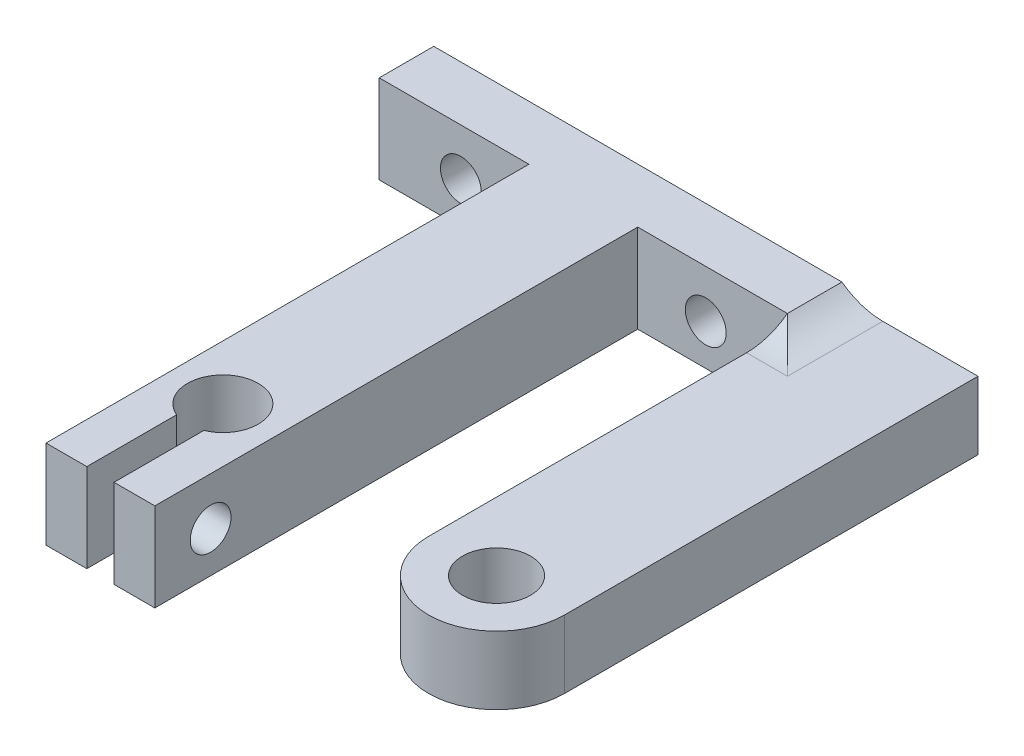
from build123d import *
from OCP.BRepFilletAPI import BRepFilletAPI_MakeChamfer

# Parameters (mm, degrees)
BOSS_EXTRUDE1_DEPTH      = 7
SKETCH2_R                = 1.5
CUT_EXTRUDE1_DEPTH       = 43.613787576
SKETCH3_R                = 1.5
CUT_EXTRUDE2_DEPTH       = 5
CHAMFER1_SIZE            = 0.5
CHAMFER1_SIZE2           = 0.595876796
BOSS_EXTRUDE2_DEPTH      = 2.5
BOSS_EXTRUDE2_DEPTH_BACK = 2.5
FILLET1_R                = 5
FILLET2_START            = -2.004201681
FILLET2_DEPTH            = 7.008403362
FILLET2_START_2          = 15
FILLET2_2_DEPTH          = 3


with BuildPart() as part:
    # Sketch1 → Boss-Extrude1 (new body)
    with BuildSketch(Plane(origin=(0, 0, 0), x_dir=(1, 0, 0), z_dir=(0, 1, 0))):
        with BuildLine():
            Line((15, 2.004201681), (-15, 2.004201681))
            Line((-15, 2.004201681), (-15, -2.004201681))
            Line((-15, -2.004201681), (-4, -2.004201681))
            Line((-4, -2.004201681), (-4, -37.495798319))
            Line((-4, -37.495798319), (-1, -37.495798319))
            Line((-1, -37.495798319), (-1, -30.895798319))
            ThreePointArc((-1, -30.895798319), (0, -25.895798319), (1, -30.895798319))
            Line((1, -30.895798319), (1, -37.495798319))
            Line((1, -37.495798319), (4, -37.495798319))
            Line((4, -37.495798319), (4, -2.004201681))
            Line((4, -2.004201681), (15, -2.004201681))
            Line((15, -2.004201681), (15, 2.004201681))
        make_face()
    extrude(amount=BOSS_EXTRUDE1_DEPTH)

    # Sketch2 → Cut-Extrude1 (cut, through all)
    with BuildSketch(Plane(origin=(4, 0, 0), x_dir=(0, 0, -1), z_dir=(1, 0, 0))):
        with Locations((-33.395798319, 3.5)):
            Circle(SKETCH2_R)
    extrude(amount=-CUT_EXTRUDE1_DEPTH, mode=Mode.SUBTRACT)

    # Sketch3 → Cut-Extrude2 (cut)
    with BuildSketch(Plane.XY.offset(2.004201681)):
        with Locations((9, 3.5)):
            Circle(SKETCH3_R)
        with Locations(Location((-9, 3.5, 0), (0, 0, 180))):
            Circle(SKETCH3_R)
    extrude(amount=-CUT_EXTRUDE2_DEPTH, mode=Mode.SUBTRACT)

    # Chamfer1: one chamfer whose edges measure the first distance from different faces: ONE call of the kernel's chamfer builder (chamfer() names one face for all edges)
    chamfer1_edges_1 = [part.edges().sort_by_distance(p)[0] for p in [
        (-1, 0, 34.195798319),
    ]]
    chamfer1_side_1 = [part.faces().sort_by_distance(p)[0] for p in [
        (-1, 3.5, 37.399590212),
    ]]
    chamfer1_edges_2 = [part.edges().sort_by_distance(p)[0] for p in [
        (-2.5, 0, 37.495798319),
    ]]
    chamfer1_side_2 = [part.faces().sort_by_distance(p)[0] for p in [
        (-2.5, 3.5, 37.495798319),
    ]]
    chamfer1_edges_3 = [part.edges().sort_by_distance(p)[0] for p in [
        (-4, 0, 19.75),
    ]]
    chamfer1_side_3 = [part.faces().sort_by_distance(p)[0] for p in [
        (-4, 3.5, 19.350383526),
    ]]
    chamfer1_edges_4 = [part.edges().sort_by_distance(p)[0] for p in [
        (-9.5, 0, 2.004201681),
    ]]
    chamfer1_side_4 = [part.faces().sort_by_distance(p)[0] for p in [
        (-14.869615952, 3.5, 2.004201681),
    ]]
    chamfer1_edges_5 = [part.edges().sort_by_distance(p)[0] for p in [
        (-15, 0, 0),
    ]]
    chamfer1_side_5 = [part.faces().sort_by_distance(p)[0] for p in [
        (-15, 3.5, 0),
    ]]
    chamfer1_edges_6 = [part.edges().sort_by_distance(p)[0] for p in [
        (0, 0, -2.004201681),
    ]]
    chamfer1_side_6 = [part.faces().sort_by_distance(p)[0] for p in [
        (0, 3.5, -2.004201681),
    ]]
    chamfer1_edges_7 = [part.edges().sort_by_distance(p)[0] for p in [
        (15, 0, 0),
    ]]
    chamfer1_side_7 = [part.faces().sort_by_distance(p)[0] for p in [
        (15, 3.5, 0),
    ]]
    chamfer1_edges_8 = [part.edges().sort_by_distance(p)[0] for p in [
        (9.5, 0, 2.004201681),
    ]]
    chamfer1_side_8 = [part.faces().sort_by_distance(p)[0] for p in [
        (4.130384048, 3.5, 2.004201681),
    ]]
    chamfer1_edges_9 = [part.edges().sort_by_distance(p)[0] for p in [
        (4, 0, 19.75),
    ]]
    chamfer1_side_9 = [part.faces().sort_by_distance(p)[0] for p in [
        (4, 3.5, 19.350383526),
    ]]
    chamfer1_edges_10 = [part.edges().sort_by_distance(p)[0] for p in [
        (2.5, 0, 37.495798319),
    ]]
    chamfer1_side_10 = [part.faces().sort_by_distance(p)[0] for p in [
        (2.5, 3.5, 37.495798319),
    ]]
    chamfer1_edges_11 = [part.edges().sort_by_distance(p)[0] for p in [
        (1, 0, 34.195798319),
    ]]
    chamfer1_side_11 = [part.faces().sort_by_distance(p)[0] for p in [
        (1, 3.5, 30.992006427),
    ]]
    chamfer1_edges_12 = [part.edges().sort_by_distance(p)[0] for p in [
        (0, 0, 25.895798319),
    ]]
    chamfer1_side_12 = [part.faces().sort_by_distance(p)[0] for p in [
        (0, 3.5, 25.895798319),
    ]]
    chamfer1 = BRepFilletAPI_MakeChamfer(part.part.solid().wrapped)
    for e in chamfer1_edges_1:
        chamfer1.Add(CHAMFER1_SIZE, CHAMFER1_SIZE2, e.wrapped, chamfer1_side_1[0].wrapped)  # the first distance lies on this face
    for e in chamfer1_edges_2:
        chamfer1.Add(CHAMFER1_SIZE, CHAMFER1_SIZE2, e.wrapped, chamfer1_side_2[0].wrapped)  # the first distance lies on this face
    for e in chamfer1_edges_3:
        chamfer1.Add(CHAMFER1_SIZE, CHAMFER1_SIZE2, e.wrapped, chamfer1_side_3[0].wrapped)  # the first distance lies on this face
    for e in chamfer1_edges_4:
        chamfer1.Add(CHAMFER1_SIZE, CHAMFER1_SIZE2, e.wrapped, chamfer1_side_4[0].wrapped)  # the first distance lies on this face
    for e in chamfer1_edges_5:
        chamfer1.Add(CHAMFER1_SIZE, CHAMFER1_SIZE2, e.wrapped, chamfer1_side_5[0].wrapped)  # the first distance lies on this face
    for e in chamfer1_edges_6:
        chamfer1.Add(CHAMFER1_SIZE, CHAMFER1_SIZE2, e.wrapped, chamfer1_side_6[0].wrapped)  # the first distance lies on this face
    for e in chamfer1_edges_7:
        chamfer1.Add(CHAMFER1_SIZE, CHAMFER1_SIZE2, e.wrapped, chamfer1_side_7[0].wrapped)  # the first distance lies on this face
    for e in chamfer1_edges_8:
        chamfer1.Add(CHAMFER1_SIZE, CHAMFER1_SIZE2, e.wrapped, chamfer1_side_8[0].wrapped)  # the first distance lies on this face
    for e in chamfer1_edges_9:
        chamfer1.Add(CHAMFER1_SIZE, CHAMFER1_SIZE2, e.wrapped, chamfer1_side_9[0].wrapped)  # the first distance lies on this face
    for e in chamfer1_edges_10:
        chamfer1.Add(CHAMFER1_SIZE, CHAMFER1_SIZE2, e.wrapped, chamfer1_side_10[0].wrapped)  # the first distance lies on this face
    for e in chamfer1_edges_11:
        chamfer1.Add(CHAMFER1_SIZE, CHAMFER1_SIZE2, e.wrapped, chamfer1_side_11[0].wrapped)  # the first distance lies on this face
    for e in chamfer1_edges_12:
        chamfer1.Add(CHAMFER1_SIZE, CHAMFER1_SIZE2, e.wrapped, chamfer1_side_12[0].wrapped)  # the first distance lies on this face
    add(Compound.cast(chamfer1.Shape()), mode=Mode.REPLACE)

    # Sketch4 → Boss-Extrude2 (add, two sides: drawn at the far end of the back side and taken through both)
    with BuildSketch(Plane(origin=(0, 3.5, 0), x_dir=(1, 0, 0), z_dir=(0, 1, 0)).offset(-BOSS_EXTRUDE2_DEPTH_BACK)):
        with BuildLine():
            Line((20, -23.382400921), (20, 2.004201681))
            Line((20, 2.004201681), (15, 2.004201681))
            Line((15, 2.004201681), (15, -28.382400921))
            ThreePointArc((15, -28.382400921), (16.464466094, -24.846867015), (20, -23.382400921))
        make_face()
        with BuildLine():
            Line((25, 2.004201681), (20, 2.004201681))
            Line((20, 2.004201681), (20, -23.382400921))
            ThreePointArc((20, -23.382400921), (23.535533906, -24.846867015), (25, -28.382400921))
            Line((25, -28.382400921), (25, 2.004201681))
        make_face()
        with BuildLine():
            ThreePointArc((25, -28.382400921), (23.535533906, -24.846867015), (20, -23.382400921))
            Line((20, -23.382400921), (20, -25.882400921))
            ThreePointArc((20, -25.882400921), (21.767766953, -26.614633968), (22.5, -28.382400921))
            ThreePointArc((22.5, -28.382400921), (21.767766953, -30.150167874), (20, -30.882400921))
            Line((20, -30.882400921), (20, -33.382400921))
            ThreePointArc((20, -33.382400921), (23.535533906, -31.917934827), (25, -28.382400921))
        make_face()
        with BuildLine():
            Line((20, -25.882400921), (20, -23.382400921))
            ThreePointArc((20, -23.382400921), (16.464466094, -24.846867015), (15, -28.382400921))
            ThreePointArc((15, -28.382400921), (16.464466094, -31.917934827), (20, -33.382400921))
            Line((20, -33.382400921), (20, -30.882400921))
            ThreePointArc((20, -30.882400921), (17.5, -28.382400921), (20, -25.882400921))
        make_face()
    extrude(amount=BOSS_EXTRUDE2_DEPTH + BOSS_EXTRUDE2_DEPTH_BACK)

    # Fillet1
    # the kernel refuses this fillet: 5 mm, written as the material it adds along each edge
    with BuildSketch(Plane(origin=(15, 6, -2.004201681), x_dir=(0, 1, 0), z_dir=(0, 0, 1))) as fillet1_piece_1:
        with BuildLine():
            CenterArc((5, -3), FILLET1_R, 143.130102354, 36.869897646)
            Line((0, -3), (0, 0))
            Line((0, 0), (1, 0))
        make_face()
    extrude(amount=4.008403361)
    # the kernel refuses this fillet: 5 mm, written as the material it takes off along each edge
    with BuildSketch(Plane(origin=(15, 0.5, 5.998839323), x_dir=(-0.7660444431189789, -0.6427876096865383, 0), z_dir=(0, 0, -1))) as fillet1_2_piece_1:
        with BuildLine():
            CenterArc((1.597855057, 5), FILLET1_R, 247.427648729, 22.572351271)
            Line((-0.321393805, 0.383022222), (0, 0))
            Line((0, 0), (1.597855057, 0))
        make_face()
    extrude(amount=11.997678646, mode=Mode.SUBTRACT)

    # Fillet2: read off the stored shape, not the designer's step
    # Fillet2 outline → Fillet2 (add)
    with BuildSketch(Plane.XY.offset(FILLET2_START)):
        with BuildLine():
            ThreePointArc((18, 6), (16.41886117, 6.25658351), (15, 7))
            Line((15, 7), (15, 6))
            Line((15, 6), (18, 6))
        make_face()
    extrude(amount=FILLET2_DEPTH)

    # Fillet2 2 outline → Fillet2 2 (cut)
    with BuildSketch(Plane.YZ.offset(FILLET2_START_2)):
        with BuildLine():
            Line((9, 5.004201681), (6, 5.004201681))
            ThreePointArc((6, 5.004201681), (6.25658351, 3.423062851), (7, 2.004201681))
            Line((7, 2.004201681), (7.75315126, 1))
            Line((7.75315126, 1), (9, 1))
            Line((9, 1), (9, 5.004201681))
        make_face()
    extrude(amount=FILLET2_2_DEPTH, mode=Mode.SUBTRACT)


solid = part.part
